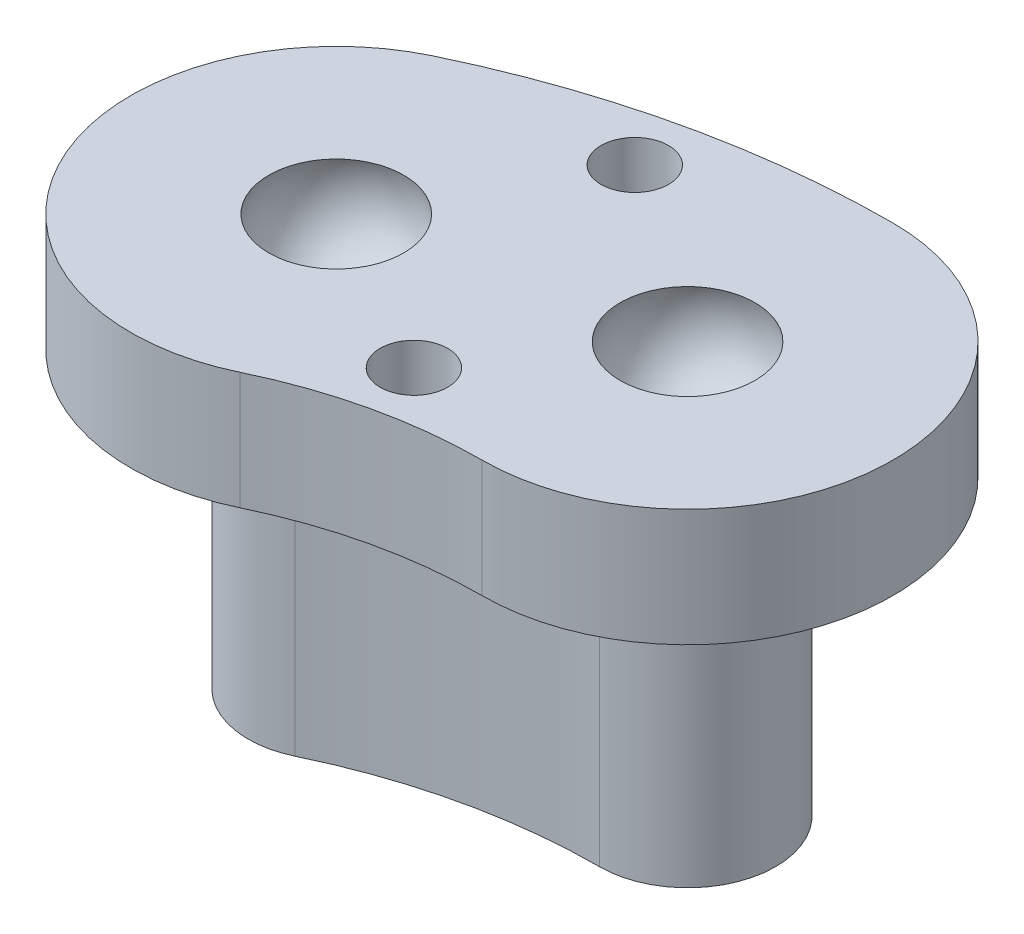
from build123d import *

# Parameters (mm, degrees)
EXTRUDE_1_DEPTH     = 10
EXTRUDE_2_DEPTH     = 4
SKETCH_6_R          = 1.15
CUT_EXTRUDE_2_DEPTH = 10


with BuildPart() as part:
    # 草图1 → 凸台-拉伸1 (new body)
    with BuildSketch(Plane(origin=(0, 0, 0), x_dir=(1, 0, 0), z_dir=(0, 1, 0))):
        with BuildLine():
            ThreePointArc((0, 25.5), (-5.666666667, 24.862399098), (-11.049955154, 22.981481481))
            ThreePointArc((-11.049955154, 22.981481481), (-12.453664134, 18.977783054), (-8.449965706, 17.574074074))
            ThreePointArc((-8.449965706, 17.574074074), (-4.333333333, 19.012422839), (0, 19.5))
            ThreePointArc((0, 19.5), (3, 22.5), (0, 25.5))
        make_face()
    extrude(amount=EXTRUDE_1_DEPTH)

    # 草图2 → 凸台-拉伸2 (add)
    with BuildSketch(Plane(origin=(0, 10, 0), x_dir=(1, 0, 0), z_dir=(0, 1, 0))):
        with BuildLine():
            ThreePointArc((0, 29.5), (-6.555555556, 28.76238327), (-12.783281453, 26.586419753))
            ThreePointArc((-12.783281453, 26.586419753), (-16.058602406, 17.244456755), (-6.716639408, 13.969135802))
            ThreePointArc((-6.716639408, 13.969135802), (-3.444444444, 15.112438667), (0, 15.5))
            ThreePointArc((0, 15.5), (7, 22.5), (0, 29.5))
        make_face()
    extrude(amount=EXTRUDE_2_DEPTH)

    # 草图3 → 切除-旋转1 (revolve, cut)
    with BuildSketch(Plane(origin=(0, 13.15, 0), x_dir=(1, 0, 0), z_dir=(0, 1, 0))):
        with BuildLine():
            Line((-9.74996043, 22.727777778), (-9.74996043, 17.827777778))
            ThreePointArc((-9.74996043, 17.827777778), (-12.19996043, 20.277777778), (-9.74996043, 22.727777778))
        make_face()
    revolve(axis=Axis((-9.74996043, 13.15, -22.727777778), (0, 0, 1)), mode=Mode.SUBTRACT)

    # 草图4 → 切除-旋转2 (revolve, cut)
    with BuildSketch(Plane(origin=(0, 13.15, 0), x_dir=(1, 0, 0), z_dir=(0, 1, 0))):
        with BuildLine():
            Line((0, 24.95), (0, 20.05))
            ThreePointArc((0, 20.05), (-2.45, 22.5), (0, 24.95))
        make_face()
    revolve(axis=Axis((0, 13.15, -24.95), (0, 0, 1)), mode=Mode.SUBTRACT)

    # 草图6 → 切除-拉伸2 (cut)
    with BuildSketch(Plane(origin=(0, 14, 0), x_dir=(1, 0, 0), z_dir=(0, 1, 0))):
        with Locations((-6.111111111, 26.812391184)):
            Circle(SKETCH_6_R)
        with Locations((-3.888888889, 17.062430753)):
            Circle(SKETCH_6_R)
    extrude(amount=-CUT_EXTRUDE_2_DEPTH, mode=Mode.SUBTRACT)


solid = part.part
